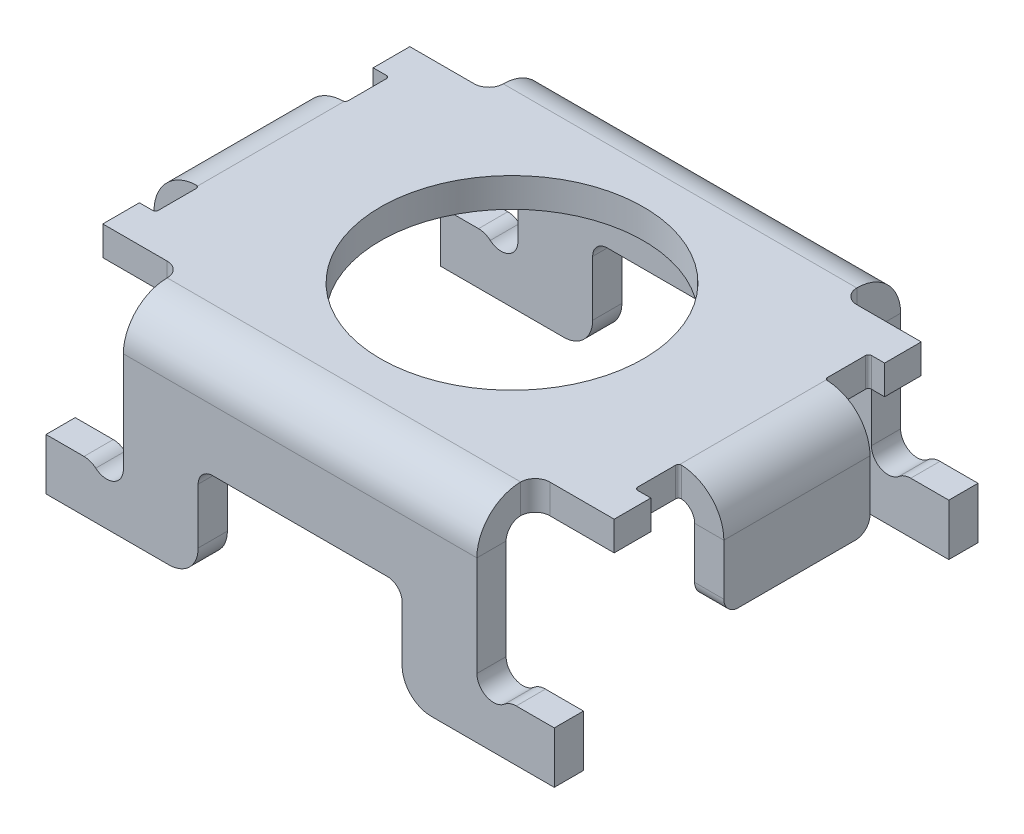
from build123d import *

# Parameters (mm, degrees)
SKETCH_3_R                       = 0.9
SM_BASE_FLANGE_1_DEPTH           = 0.2
SM_EDGE_FLANGE_3_DEPTH           = 0.169178
SM_START                         = 1.15
SM_EDGE_FLANGE_3_2_DEPTH         = 0.3
SM_START_2                       = -1.739216372
SM_EDGE_FLANGE_3_3_DEPTH         = 3.478432744
SM_START_3                       = -1.209627878
SM_EDGE_FLANGE_3_4_DEPTH         = 2.419255168
SM_EDGE_FLANGE_4_STRIP_W         = 1
SM_EDGE_FLANGE_4_STRIP_H         = 0.2
SM_EDGE_FLANGE_4_STRIP_CUT_DEPTH = 1
SM_EDGE_FLANGE_4_DEPTH           = 1
SM_START_4                       = 0.2
SM_EDGE_FLANGE_4_FLAT_DEPTH      = 0.2


with BuildPart() as part:
    # 基体-法兰1: sheet metal written as solids
    # 草图3 → 基体-法兰1 (new body)
    with BuildSketch(Plane(origin=(0, 0, 0), x_dir=(1, 0, 0), z_dir=(0, 1, 0))):
        with BuildLine():
            Line((1.75, 0.5), (1.75, -0.5))
            Line((1.75, -0.5), (1.690116035, -0.5))
            Line((1.690116035, -0.5), (1.660116035, -0.5))
            ThreePointArc((1.660116035, -0.5), (1.645973899, -0.505857864), (1.640116035, -0.52))
            Line((1.640116035, -0.52), (1.640116035, -0.55))
            Line((1.640116035, -0.55), (1.640116035, -0.75))
            Line((1.640116035, -0.75), (1.640116035, -0.78))
            ThreePointArc((1.640116035, -0.78), (1.645973899, -0.794142136), (1.660116035, -0.8))
            Line((1.660116035, -0.8), (1.690116035, -0.8))
            Line((1.690116035, -0.8), (1.75, -0.8))
            Line((1.75, -0.8), (1.75, -1.050703944))
            Line((1.75, -1.050703944), (1.309627878, -1.050703944))
            ThreePointArc((1.309627878, -1.050703944), (1.2389172, -1.079993266), (1.209627878, -1.150703944))
            Line((1.209627878, -1.150703944), (1.209627878, -1.244254067))
            Line((1.209627878, -1.244254067), (1.209627878, -1.25))
            Line((1.209627878, -1.25), (1.121614786, -1.25))
            Line((1.121614786, -1.25), (-1.121614786, -1.25))
            Line((-1.121614786, -1.25), (-1.209627878, -1.25))
            Line((-1.209627878, -1.25), (-1.209627878, -1.244254067))
            Line((-1.209627878, -1.244254067), (-1.209627878, -1.150703944))
            ThreePointArc((-1.209627878, -1.150703944), (-1.2389172, -1.079993266), (-1.309627878, -1.050703944))
            Line((-1.309627878, -1.050703944), (-1.75, -1.050703944))
            Line((-1.75, -1.050703944), (-1.75, -0.8))
            Line((-1.75, -0.8), (-1.690116035, -0.8))
            Line((-1.690116035, -0.8), (-1.660116035, -0.8))
            ThreePointArc((-1.660116035, -0.8), (-1.645973899, -0.794142136), (-1.640116035, -0.78))
            Line((-1.640116035, -0.78), (-1.640116035, -0.75))
            Line((-1.640116035, -0.75), (-1.640116035, -0.55))
            Line((-1.640116035, -0.55), (-1.640116035, -0.52))
            ThreePointArc((-1.640116035, -0.52), (-1.645973899, -0.505857864), (-1.660116035, -0.5))
            Line((-1.660116035, -0.5), (-1.690116035, -0.5))
            Line((-1.690116035, -0.5), (-1.75, -0.5))
            Line((-1.75, -0.5), (-1.75, 0.5))
            Line((-1.75, 0.5), (-1.690116035, 0.5))
            Line((-1.690116035, 0.5), (-1.660116035, 0.5))
            ThreePointArc((-1.660116035, 0.5), (-1.645973899, 0.505857864), (-1.640116035, 0.52))
            Line((-1.640116035, 0.52), (-1.640116035, 0.55))
            Line((-1.640116035, 0.55), (-1.640116035, 0.75))
            Line((-1.640116035, 0.75), (-1.640116035, 0.78))
            ThreePointArc((-1.640116035, 0.78), (-1.645973899, 0.794142136), (-1.660116035, 0.8))
            Line((-1.660116035, 0.8), (-1.690116035, 0.8))
            Line((-1.690116035, 0.8), (-1.75, 0.8))
            Line((-1.75, 0.8), (-1.75, 1.050703944))
            Line((-1.75, 1.050703944), (-1.309627878, 1.050703944))
            ThreePointArc((-1.309627878, 1.050703944), (-1.2389172, 1.079993266), (-1.209627878, 1.150703944))
            Line((-1.209627878, 1.150703944), (-1.209627878, 1.244254067))
            Line((-1.209627878, 1.244254067), (-1.209627878, 1.25))
            Line((-1.209627878, 1.25), (-1.121614786, 1.25))
            Line((-1.121614786, 1.25), (1.121614786, 1.25))
            Line((1.121614786, 1.25), (1.209627878, 1.25))
            Line((1.209627878, 1.25), (1.209627878, 1.244254067))
            Line((1.209627878, 1.244254067), (1.209627878, 1.150703944))
            ThreePointArc((1.209627878, 1.150703944), (1.2389172, 1.079993266), (1.309627878, 1.050703944))
            Line((1.309627878, 1.050703944), (1.75, 1.050703944))
            Line((1.75, 1.050703944), (1.75, 0.8))
            Line((1.75, 0.8), (1.690116035, 0.8))
            Line((1.690116035, 0.8), (1.660116035, 0.8))
            ThreePointArc((1.660116035, 0.8), (1.645973899, 0.794142136), (1.640116035, 0.78))
            Line((1.640116035, 0.78), (1.640116035, 0.75))
            Line((1.640116035, 0.75), (1.640116035, 0.55))
            Line((1.640116035, 0.55), (1.640116035, 0.52))
            ThreePointArc((1.640116035, 0.52), (1.645973899, 0.505857864), (1.660116035, 0.5))
            Line((1.660116035, 0.5), (1.690116035, 0.5))
            Line((1.690116035, 0.5), (1.75, 0.5))
        make_face()
        with Locations(Location((0, 0, 0), (0, 0, 270))):
            Circle(SKETCH_3_R, mode=Mode.SUBTRACT)
    extrude(amount=SM_BASE_FLANGE_1_DEPTH)

    # 边线-法兰3: read off the stored shape, not the designer's step
    # 边线-法兰3 outline → 边线-法兰3 (add)
    with BuildSketch(Plane(origin=(0, 0, 1.25), x_dir=(-1, 0, 0), z_dir=(0, 0, 1))):
        with BuildLine():
            Line((-1.20962729, 0.785296441), (-1.209627878, 0))
            Line((-1.209627878, 0), (1.209627878, 0))
            Line((1.209627878, 0), (1.20962729, 0.785296441))
            ThreePointArc((1.20962729, 0.785296441), (1.276253046, 0.889408078), (1.398699548, 0.872523806))
            ThreePointArc((1.398699548, 0.872523806), (1.436230193, 0.850547775), (1.479045273, 0.842908124))
            Line((1.479045273, 0.842908124), (1.739216372, 0.842908124))
            Line((1.739216372, 0.842908124), (1.739216372, 1.195393252))
            Line((1.739216372, 1.195393252), (0.897930032, 1.195393252))
            ThreePointArc((0.897930032, 1.195393252), (0.756508676, 1.136814608), (0.697930032, 0.995393252))
            Line((0.697930032, 0.995393252), (0.697930032, 0.616780813))
            ThreePointArc((0.697930032, 0.616780813), (0.66864071, 0.546070134), (0.597930032, 0.516780813))
            Line((0.597930032, 0.516780813), (-0.597930032, 0.516780813))
            ThreePointArc((-0.597930032, 0.516780813), (-0.66864071, 0.546070135), (-0.697930032, 0.616780813))
            Line((-0.697930032, 0.616780813), (-0.697930032, 0.995393252))
            ThreePointArc((-0.697930032, 0.995393252), (-0.756508676, 1.136814608), (-0.897930032, 1.195393252))
            Line((-0.897930032, 1.195393252), (-1.739216372, 1.195393252))
            Line((-1.739216372, 1.195393252), (-1.739216372, 0.842908124))
            Line((-1.739216372, 0.842908124), (-1.479045273, 0.842908124))
            ThreePointArc((-1.479045273, 0.842908124), (-1.436230193, 0.850547775), (-1.398699548, 0.872523806))
            ThreePointArc((-1.398699548, 0.872523806), (-1.276253046, 0.889408078), (-1.20962729, 0.785296441))
        make_face()
    sm_edge_flange_3 = extrude(amount=SM_EDGE_FLANGE_3_DEPTH)

    # Sm Edge Flange 3 2 outline → Sm Edge Flange 3 2 (add)
    with BuildSketch(Plane.XY.offset(SM_START)):
        with BuildLine():
            Line((1.20962729, -0.785296441), (1.209627878, 0))
            Line((1.209627878, 0), (-1.209627878, 0))
            Line((-1.209627878, 0), (-1.20962729, -0.785296441))
            ThreePointArc((-1.20962729, -0.785296441), (-1.276253046, -0.889408078), (-1.398699548, -0.872523806))
            ThreePointArc((-1.398699548, -0.872523806), (-1.436230193, -0.850547775), (-1.479045273, -0.842908124))
            Line((-1.479045273, -0.842908124), (-1.739216372, -0.842908124))
            Line((-1.739216372, -0.842908124), (-1.739216372, -1.195393252))
            Line((-1.739216372, -1.195393252), (-0.897930032, -1.195393252))
            ThreePointArc((-0.897930032, -1.195393252), (-0.756508676, -1.136814608), (-0.697930032, -0.995393252))
            Line((-0.697930032, -0.995393252), (-0.697930032, -0.616780813))
            ThreePointArc((-0.697930032, -0.616780813), (-0.66864071, -0.546070134), (-0.597930032, -0.516780813))
            Line((-0.597930032, -0.516780813), (0.597930032, -0.516780813))
            ThreePointArc((0.597930032, -0.516780813), (0.66864071, -0.546070135), (0.697930032, -0.616780813))
            Line((0.697930032, -0.616780813), (0.697930032, -0.995393252))
            ThreePointArc((0.697930032, -0.995393252), (0.756508676, -1.136814608), (0.897930032, -1.195393252))
            Line((0.897930032, -1.195393252), (1.739216372, -1.195393252))
            Line((1.739216372, -1.195393252), (1.739216372, -0.842908124))
            Line((1.739216372, -0.842908124), (1.479045273, -0.842908124))
            ThreePointArc((1.479045273, -0.842908124), (1.436230193, -0.850547775), (1.398699548, -0.872523806))
            ThreePointArc((1.398699548, -0.872523806), (1.276253046, -0.889408078), (1.20962729, -0.785296441))
        make_face()
    sm_edge_flange_3_2 = extrude(amount=SM_EDGE_FLANGE_3_2_DEPTH)

    # Sm Edge Flange 3 3 outline → Sm Edge Flange 3 3 (cut)
    with BuildSketch(Plane.YZ.offset(SM_START_2)):
        with BuildLine():
            Line((0, 1.45), (-0.1, 1.45))
            ThreePointArc((-0.1, 1.45), (-0.049269406, 1.445679568), (0, 1.432842712))
            Line((0, 1.432842712), (0, 1.45))
        make_face()
        with BuildLine():
            Line((0.2, 1.25), (0.182842712, 1.25))
            ThreePointArc((0.182842712, 1.25), (0.195679568, 1.200730594), (0.2, 1.15))
            Line((0.2, 1.15), (0.2, 1.25))
        make_face()
        with BuildLine():
            ThreePointArc((0, 1.15), (-0.029289322, 1.220710678), (-0.1, 1.25))
            Line((-0.1, 1.25), (-1.195393252, 1.25))
            Line((-1.195393252, 1.25), (-1.195393252, 1.15))
            Line((-1.195393252, 1.15), (0, 1.15))
        make_face()
    sm_edge_flange_3_3 = extrude(amount=SM_EDGE_FLANGE_3_3_DEPTH, mode=Mode.SUBTRACT)

    # Sm Edge Flange 3 4 outline → Sm Edge Flange 3 4 (add)
    with BuildSketch(Plane.YZ.offset(SM_START_3)):
        with BuildLine():
            ThreePointArc((0.182842712, 1.25), (0.112132034, 1.362132034), (0, 1.432842712))
            Line((0, 1.432842712), (0, 1.25))
            Line((0, 1.25), (0.182842712, 1.25))
        make_face()
    sm_edge_flange_3_4 = extrude(amount=SM_EDGE_FLANGE_3_4_DEPTH)

    # 镜向2: 边线-法兰3, Sm Edge Flange 3 2, Sm Edge Flange 3 3, Sm Edge Flange 3 4 across plane
    add(sm_edge_flange_3.mirror(Plane.XY))
    add(sm_edge_flange_3_2.mirror(Plane.XY))
    add(sm_edge_flange_3_3.mirror(Plane.XY), mode=Mode.SUBTRACT)
    add(sm_edge_flange_3_4.mirror(Plane.XY))

    # 边线-法兰4: sheet metal written as solids
    # 边线-法兰4 strip (on a plane across the edge) → 边线-法兰4 strip cut (cut)
    with BuildSketch(Plane(origin=(-1.75, 0, 0.5), x_dir=(1, 0, 0), z_dir=(0, 0, -1))):
        with Locations((-0.4, -0.1)):
            Rectangle(SM_EDGE_FLANGE_4_STRIP_W, SM_EDGE_FLANGE_4_STRIP_H)
    sm_edge_flange_4_strip_cut = extrude(amount=SM_EDGE_FLANGE_4_STRIP_CUT_DEPTH, mode=Mode.SUBTRACT)

    # 边线-法兰4 bend section (on a plane across the edge) → 边线-法兰4 (add)
    with BuildSketch(Plane(origin=(-1.75, 0, 0.5), x_dir=(1, 0, 0), z_dir=(0, 0, -1))):
        with BuildLine():
            Line((-0.2, 0.1), (0, 0.1))
            ThreePointArc((0, 0.1), (0.029289322, 0.029289322), (0.1, 0))
            Line((0.1, 0), (0.1, -0.2))
            ThreePointArc((0.1, -0.2), (-0.112132034, -0.112132034), (-0.2, 0.1))
        make_face()
    sm_edge_flange_4 = extrude(amount=SM_EDGE_FLANGE_4_DEPTH)

    # 边线-法兰4 profile (on flange) → 边线-法兰4 flat (add)
    with BuildSketch(Plane(origin=(-1.75, 0, 0), x_dir=(0, 0, -1), z_dir=(-1, 0, 0)).offset(SM_START_4)):
        with BuildLine():
            Line((0.5, 0.1), (0.5, 0.45))
            ThreePointArc((0.5, 0.45), (0.470710678, 0.520710678), (0.4, 0.55))
            Line((0.4, 0.55), (-0.4, 0.55))
            ThreePointArc((-0.4, 0.55), (-0.470710678, 0.520710678), (-0.5, 0.45))
            Line((-0.5, 0.45), (-0.5, 0.1))
            Line((-0.5, 0.1), (0.5, 0.1))
        make_face()
    sm_edge_flange_4_flat = extrude(amount=-SM_EDGE_FLANGE_4_FLAT_DEPTH)

    # 镜向3: 边线-法兰4 strip cut, 边线-法兰4, 边线-法兰4 flat across plane
    add(sm_edge_flange_4_strip_cut.mirror(Plane(origin=(0, 0, 0), x_dir=(0, 0, 1), z_dir=(1, 0, 0))), mode=Mode.SUBTRACT)
    add(sm_edge_flange_4.mirror(Plane(origin=(0, 0, 0), x_dir=(0, 0, 1), z_dir=(1, 0, 0))))
    add(sm_edge_flange_4_flat.mirror(Plane(origin=(0, 0, 0), x_dir=(0, 0, 1), z_dir=(1, 0, 0))))


solid = part.part
